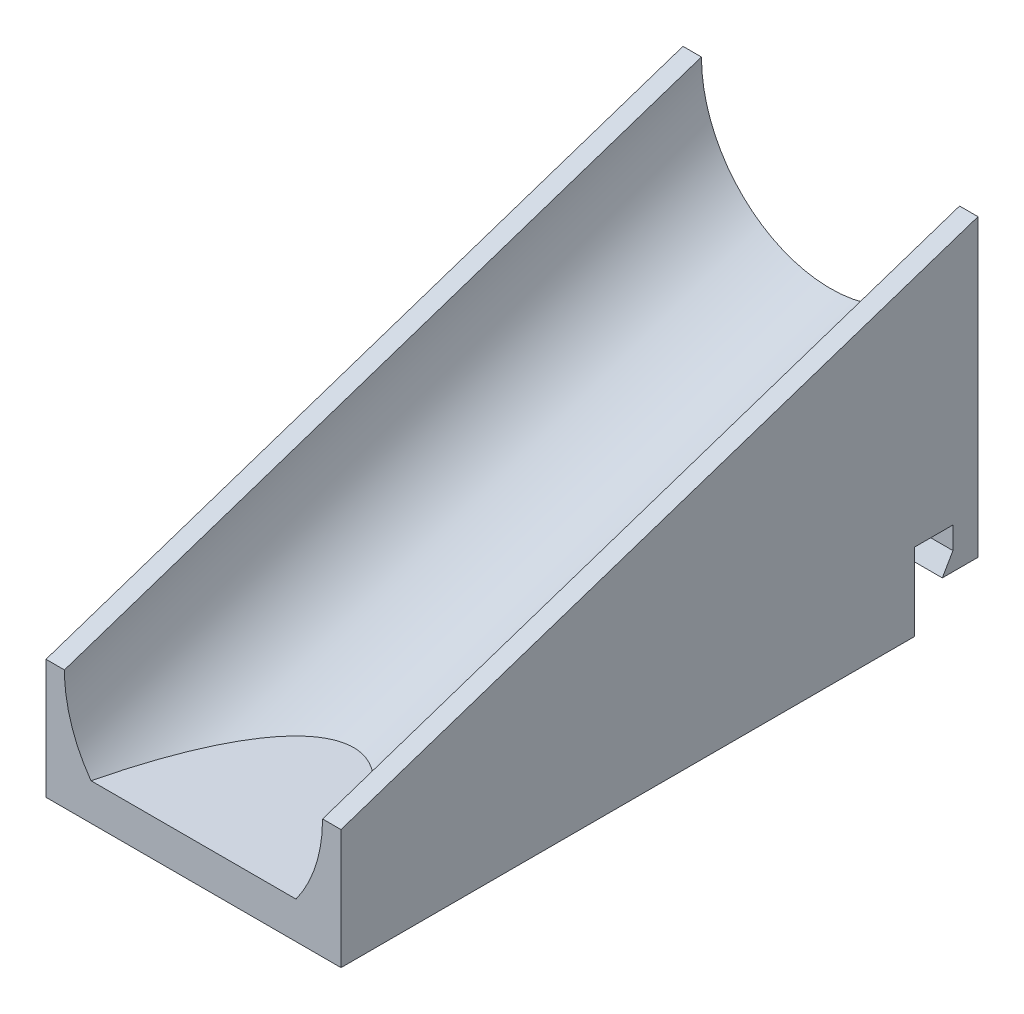
from build123d import *

# Parameters (mm, degrees)
SKETCH1_W           = 101.6
SKETCH1_H           = 304.8
BOSS_EXTRUDE1_DEPTH = 101.6
CUT_EXTRUDE1_DEPTH  = 101.6
SKETCH4_R           = 44.45
CUT_EXTRUDE2_DEPTH  = 508
SKETCH7_W           = 13.154000108
SKETCH7_H           = 13.97
CUT_EXTRUDE3_DEPTH  = 152.4
SKETCH8_W           = 101.6
SKETCH8_H           = 6.985
BOSS_EXTRUDE2_DEPTH = 6.35
CHAMFER1_SIZE       = 6.731
CHAMFER1_SIZE_2     = 11.658433986
SKETCH9_W           = 101.6
SKETCH9_H           = 292.826685396
BOSS_EXTRUDE3_DEPTH = 12.7
SKETCH10_W          = 101.6
SKETCH10_H          = 95.25
CUT_EXTRUDE4_DEPTH  = 58.42


with BuildPart() as part:
    # Sketch1 → Boss-Extrude1 (new body)
    with BuildSketch(Plane(origin=(0, 0, 0), x_dir=(1, 0, 0), z_dir=(0, 1, 0))):
        with Locations((50.8, -152.4)):
            Rectangle(SKETCH1_W, SKETCH1_H)
    extrude(amount=BOSS_EXTRUDE1_DEPTH)

    # Sketch3 → Cut-Extrude1 (cut)
    with BuildSketch(Plane(origin=(101.6, 0, 0), x_dir=(0, 0, -1), z_dir=(1, 0, 0))):
        Polygon((-304.8, 0), (0, 101.6), (-304.8, 101.6), align=None)
    extrude(amount=-CUT_EXTRUDE1_DEPTH, mode=Mode.SUBTRACT)

    # Sketch4 → Cut-Extrude2 (cut)
    with BuildSketch(Plane(origin=(0, 10.16, -30.48), x_dir=(-1, 0, 0), z_dir=(0, 0.31622776601683794, -0.9486832980505139))):
        with Locations((-50.8, 96.386223082)):
            Circle(SKETCH4_R)
    extrude(amount=-CUT_EXTRUDE2_DEPTH, mode=Mode.SUBTRACT)

    # Sketch7 → Cut-Extrude3 (cut)
    with BuildSketch(Plane(origin=(101.6, 0, 0), x_dir=(0, 0, -1), z_dir=(1, 0, 0))):
        with Locations((-15.213000054, 6.985)):
            Rectangle(SKETCH7_W, SKETCH7_H)
    extrude(amount=-CUT_EXTRUDE3_DEPTH, mode=Mode.SUBTRACT)

    # Sketch8 → Boss-Extrude2 (add)
    with BuildSketch(Plane.XY.offset(8.636)):
        with Locations((50.8, 3.4925)):
            Rectangle(SKETCH8_W, SKETCH8_H)
    extrude(amount=BOSS_EXTRUDE2_DEPTH)

    # Chamfer1
    # the kernel refuses this chamfer: 11.658433986, 6.731 mm, written as the material it takes off along each edge
    with BuildSketch(Plane(origin=(-30.161368486, 6.985, 14.986), x_dir=(0, 0.057893862402671366, -0.9983227437537926), z_dir=(1, 0, 0))) as chamfer1_piece_1_section:
        Polygon((CHAMFER1_SIZE * 0.998322743754, -CHAMFER1_SIZE * 0.0578938624027), (-CHAMFER1_SIZE_2 * 0.0578938624014, -CHAMFER1_SIZE_2 * 0.998322743732), (0, 0), align=None)
    chamfer1_piece_1 = extrude(amount=161.922736972, mode=Mode.PRIVATE)
    chamfer1_piece_1 = split(chamfer1_piece_1, bisect_by=Plane(origin=(50.8, 3.03450116, 8.636), z_dir=(0, 0, 1)), keep=Keep.TOP, mode=Mode.PRIVATE)
    add(chamfer1_piece_1, mode=Mode.SUBTRACT)

    # Sketch9 → Boss-Extrude3 (add)
    with BuildSketch(Plane.XZ):
        with Locations((50.8, 168.203342806)):
            Rectangle(SKETCH9_W, SKETCH9_H)
    extrude(amount=BOSS_EXTRUDE3_DEPTH)

    # Sketch10 → Cut-Extrude4 (cut)
    with BuildSketch(Plane(origin=(0, -12.7, 0), x_dir=(-1, 0, 0), z_dir=(0, -1, 0))):
        with Locations((-50.8, -266.991685504)):
            Rectangle(SKETCH10_W, SKETCH10_H)
    extrude(amount=-CUT_EXTRUDE4_DEPTH, mode=Mode.SUBTRACT)


solid = part.part
